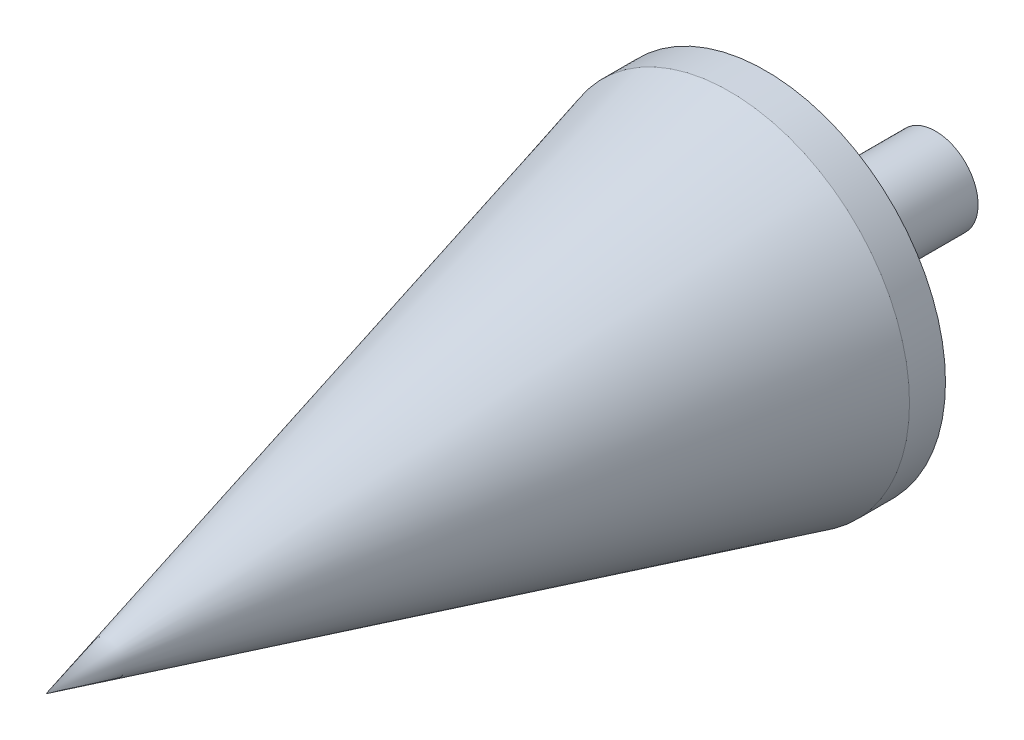
from build123d import *

# Parameters (mm, degrees)
SKETCH1_R           = 6.35
BOSS_EXTRUDE1_DEPTH = 1.27
SKETCH3_R           = 1.5
BOSS_EXTRUDE2_DEPTH = 6


# Read off the part's stored shape, not the designer's step: Loft1
with BuildPart() as part:
    # Sketch1 → Boss-Extrude1 (new body)
    with BuildSketch(Plane.XY):
        Circle(SKETCH1_R)
    extrude(amount=BOSS_EXTRUDE1_DEPTH)

    # Loft1 outline → Loft1 (revolve)
    with BuildSketch(Plane.XZ):
        Polygon((6.35, 1.27), (0, 25.4), (0, 1.27), align=None)
    revolve(axis=Axis((0, 0, 0), (0, 0, 1)))

    # Sketch3 → Boss-Extrude2 (add)
    with BuildSketch(Plane(origin=(0, 0, 0), x_dir=(-1, 0, 0), z_dir=(0, 0, -1))):
        Circle(SKETCH3_R)
    extrude(amount=BOSS_EXTRUDE2_DEPTH)


solid = part.part
